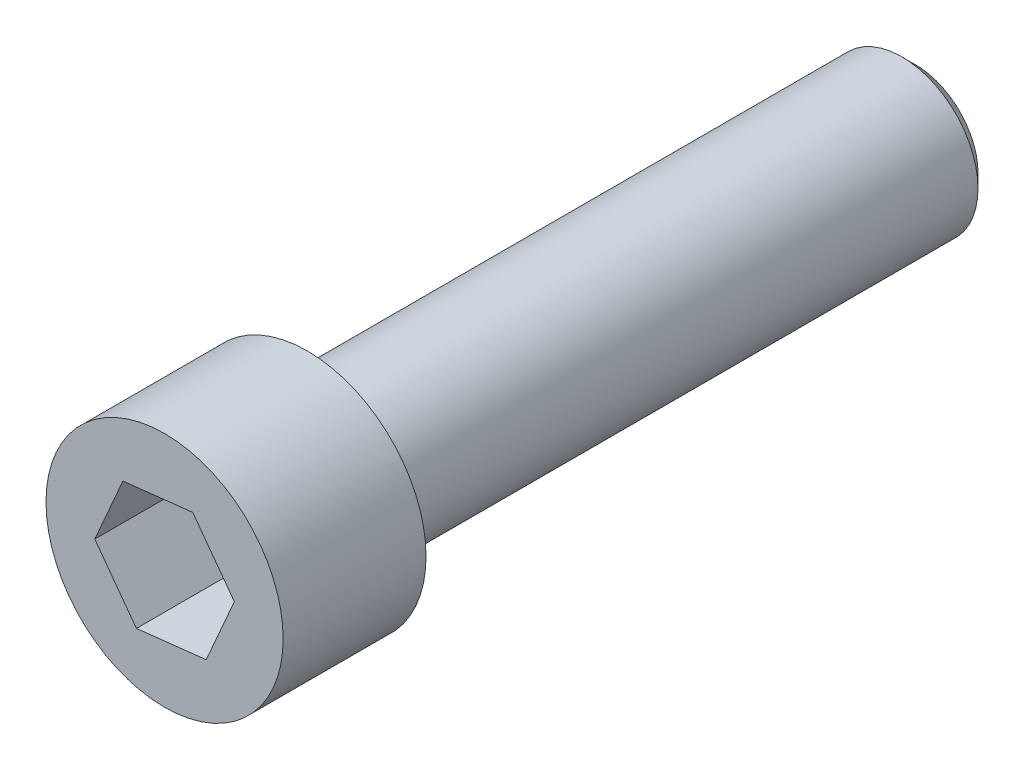
from build123d import *

# Parameters (mm, degrees)
SKETCH1_R           = 3.9
BOSS_EXTRUDE1_DEPTH = 4.7
CUT_EXTRUDE1_DEPTH  = 3.2


# Read off the part's stored shape, not the designer's step: M5x0.8 Machine Threads Stud1
with BuildPart() as part:
    # Sketch1 → Boss-Extrude1 (new body)
    with BuildSketch(Plane.XY):
        Circle(SKETCH1_R)
    extrude(amount=BOSS_EXTRUDE1_DEPTH)

    # M5x0.8 Machine Threads Stud1 outline → M5x0.8 Machine Threads Stud1 (revolve)
    with BuildSketch(Plane.XZ):
        Polygon((0, 0), (0, -20), (2.055, -20), (2.5, -19.555), (2.5, 0), align=None)
    revolve(axis=Axis((0, 0, 0), (0, 0, 1)))

    # Sketch5 → Cut-Extrude1 (cut)
    with BuildSketch(Plane.XY.offset(4.7)):
        Polygon((1.368919171, -1.859944525), (2.295218794, 0.255546515), (0.926299623, 2.11549104), (-1.368919171, 1.859944525), (-2.295218794, -0.255546515), (-0.926299623, -2.11549104), align=None)
    extrude(amount=-CUT_EXTRUDE1_DEPTH, mode=Mode.SUBTRACT)


solid = part.part
